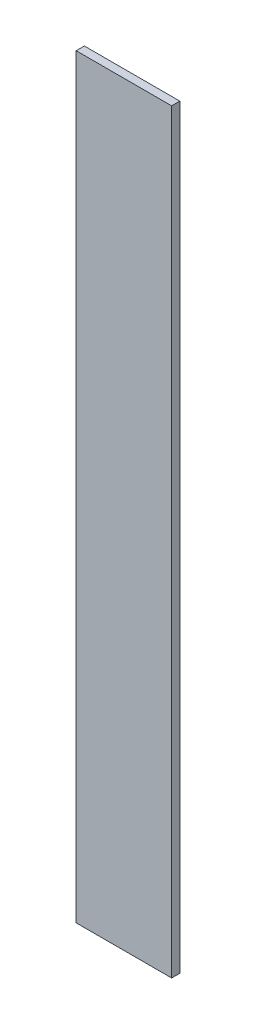
from build123d import *

# Parameters (mm, degrees)
SKETCH1_W           = 35
SKETCH1_H           = 277
BOSS_EXTRUDE1_DEPTH = 3


with BuildPart() as part:
    # Sketch1 → Boss-Extrude1 (new body)
    with BuildSketch(Plane.XY):
        Rectangle(SKETCH1_W, SKETCH1_H)
    extrude(amount=BOSS_EXTRUDE1_DEPTH)


solid = part.part
